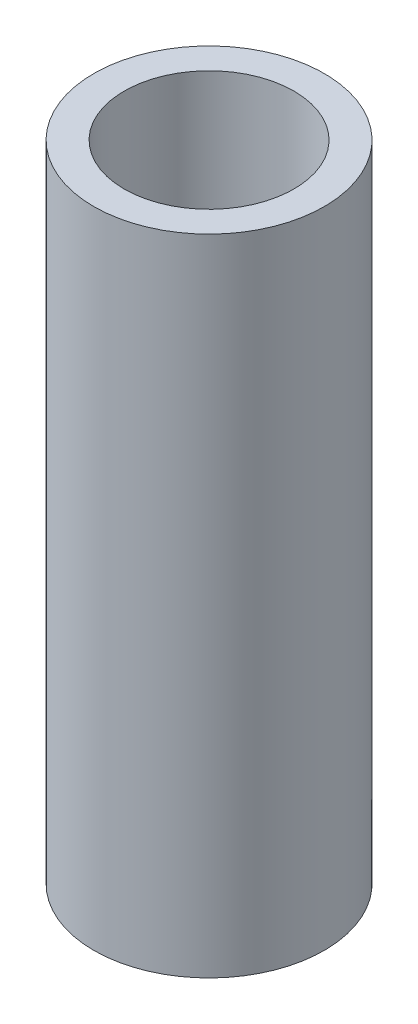
from build123d import *

# Parameters (mm, degrees)
SKETCH1_R           = 12.5
BOSS_EXTRUDE1_DEPTH = 69.86915713
SKETCH2_R           = 9.205370883
CUT_EXTRUDE1_DEPTH  = 73.070792406


with BuildPart() as part:
    # Sketch1 → Boss-Extrude1 (new body)
    with BuildSketch(Plane(origin=(0, 0, 0), x_dir=(1, 0, 0), z_dir=(0, 1, 0))):
        Circle(SKETCH1_R)
    extrude(amount=BOSS_EXTRUDE1_DEPTH)

    # Sketch2 → Cut-Extrude1 (cut, through all)
    with BuildSketch(Plane(origin=(0, 0, 0), x_dir=(1, 0, 0), z_dir=(0, 1, 0))):
        Circle(SKETCH2_R)
    extrude(amount=CUT_EXTRUDE1_DEPTH, mode=Mode.SUBTRACT)


solid = part.part
